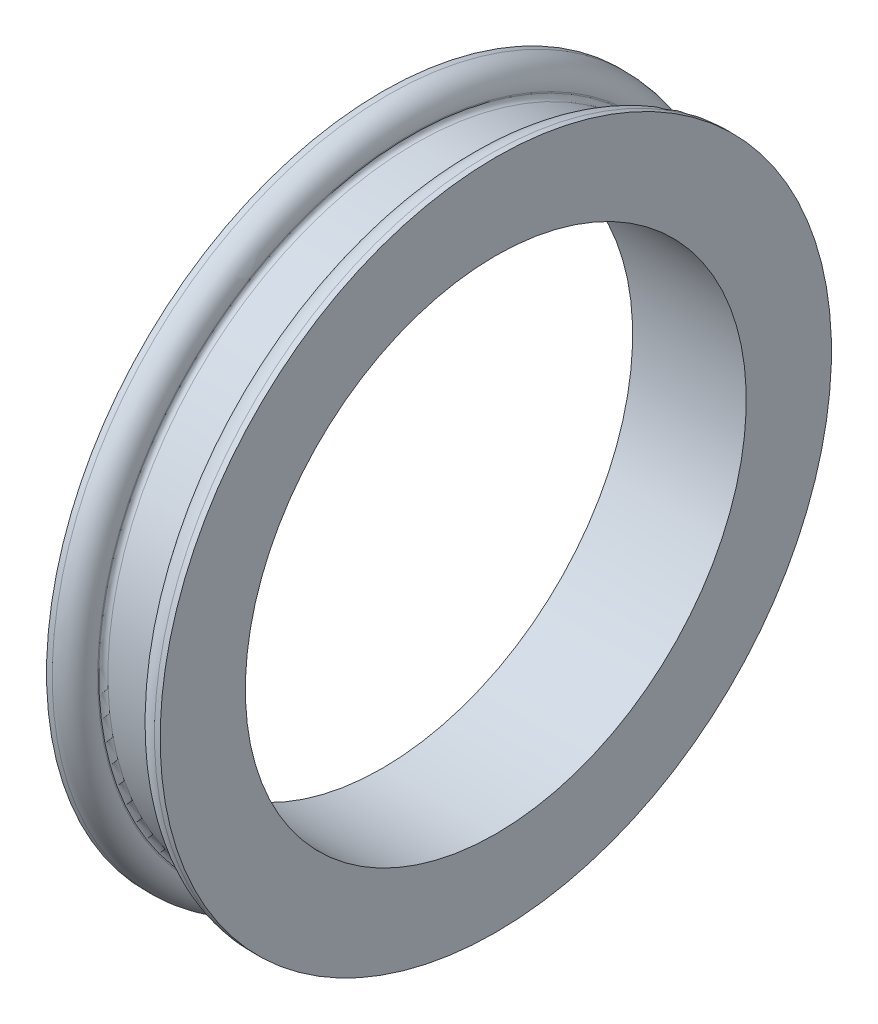
from build123d import *


with BuildPart() as part:
    # Sketch1 → Revolve1 (revolve)
    with BuildSketch(Plane.XY):
        with BuildLine():
            Line((-3.175, 14), (3.175, 14))
            Line((3.175, 14), (3.175, 18.7625))
            Line((3.175, 18.7625), (2.8575, 18.7625))
            ThreePointArc((2.8575, 18.7625), (1.959474388, 18.390525612), (1.5875, 17.4925))
            Line((1.5875, 17.4925), (1.5875, 17.429))
            ThreePointArc((1.5875, 17.429), (1.513105122, 17.249394878), (1.3335, 17.175))
            Line((1.3335, 17.175), (-1.3335, 17.175))
            ThreePointArc((-1.3335, 17.175), (-1.513105122, 17.249394878), (-1.5875, 17.429))
            Line((-1.5875, 17.429), (-1.5875, 17.4925))
            ThreePointArc((-1.5875, 17.4925), (-1.959474388, 18.390525612), (-2.8575, 18.7625))
            Line((-2.8575, 18.7625), (-3.175, 18.7625))
            Line((-3.175, 18.7625), (-3.175, 14))
        make_face()
    revolve(axis=Axis((-11.227577628, 0, 0), (1, 0, 0)))


solid = part.part
